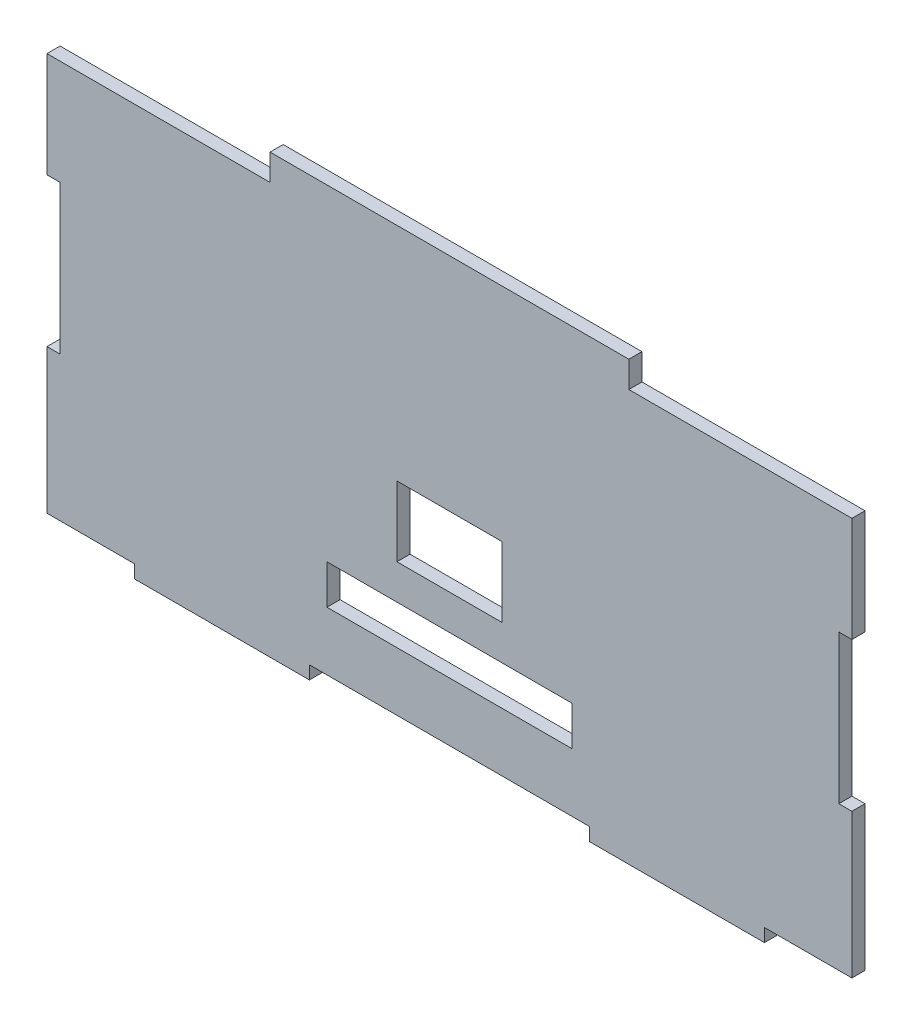
from build123d import *

# Parameters (mm, degrees)
BOSS_EXTRUDE1_DEPTH = 1.5
SKETCH2_W           = 28
SKETCH2_H           = 4.5
SKETCH2_W_2         = 12
SKETCH2_H_2         = 8
CUT_EXTRUDE2_DEPTH  = 54.108379753
SKETCH3_W           = 1.5
SKETCH3_H           = 17
SKETCH3_W_2         = 10
SKETCH3_H_2         = 1.5
SKETCH3_W_3         = 32
CUT_EXTRUDE3_DEPTH  = 54.108379753


with BuildPart() as part:
    # Sketch1 → Boss-Extrude1 (new body)
    with BuildSketch(Plane.XY):
        Polygon((-46, 23.5), (-20.5, 23.5), (-20.5, 26.5), (20.5, 26.5), (20.5, 23.5), (46, 23.5), (46, -23.5), (-46, -23.5), align=None)
    extrude(amount=-BOSS_EXTRUDE1_DEPTH)

    # Sketch2 → Cut-Extrude2 (cut, through all)
    with BuildSketch(Plane.XY):
        with Locations((0, -13.05)):
            Rectangle(SKETCH2_W, SKETCH2_H)
        with Locations((0, -2.8)):
            Rectangle(SKETCH2_W_2, SKETCH2_H_2)
    extrude(amount=-CUT_EXTRUDE2_DEPTH, mode=Mode.SUBTRACT)

    # Sketch3 → Cut-Extrude3 (cut, through all)
    with BuildSketch(Plane.XY):
        with Locations((-45.25, 3)):
            Rectangle(SKETCH3_W, SKETCH3_H)
        with Locations((-41, -22.75)):
            Rectangle(SKETCH3_W_2, SKETCH3_H_2)
        with Locations((0, -22.75)):
            Rectangle(SKETCH3_W_3, SKETCH3_H_2)
        with Locations((41, -22.75)):
            Rectangle(SKETCH3_W_2, SKETCH3_H_2)
        with Locations((45.25, 3)):
            Rectangle(SKETCH3_W, SKETCH3_H)
    extrude(amount=-CUT_EXTRUDE3_DEPTH, mode=Mode.SUBTRACT)


solid = part.part
